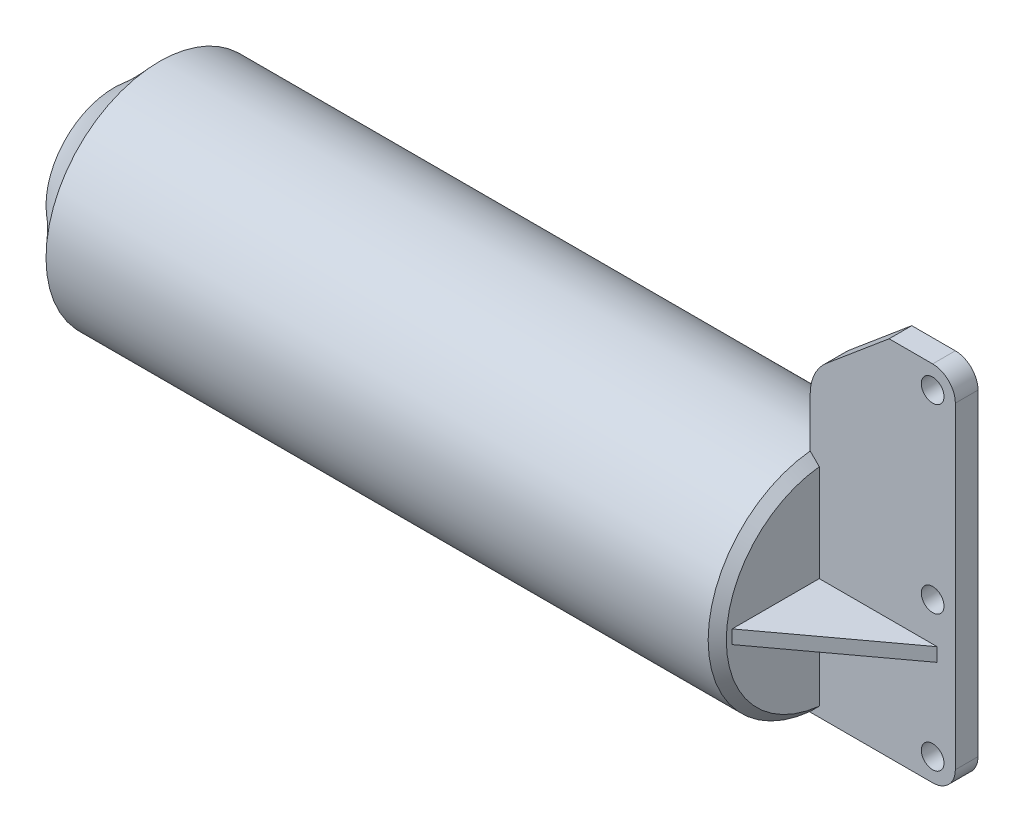
from build123d import *
from build123d.topology import SkipClean

# Parameters (mm, degrees)
SKETCH1_R                = 12.5
BOSS_EXTRUDE1_DEPTH      = 59
SKETCH2_R                = 7.5
BOSS_EXTRUDE2_DEPTH      = 5
CHAMFER1_SIZE            = 1
BOSS_EXTRUDE3_DEPTH      = 27.5
BOSS_EXTRUDE3_DEPTH_BACK = 12.5
FILLET1_R                = 2.5
SKETCH4_R                = 1.25
CUT_EXTRUDE1_DEPTH       = 27.5
CUT_EXTRUDE2_DEPTH       = 27.5
FILLET2_R                = 5
SKETCH6_R                = 1.25
CUT_EXTRUDE3_DEPTH       = 27.5
RIB1_REACH               = 81.928
SKETCH7_WALL_W           = 178.016630936
SKETCH7_WALL_H           = 1.5
SKETCH9_R                = 12.5
BOSS_EXTRUDE5_DEPTH      = 10
SKETCH10_R               = 12.5
BOSS_EXTRUDE6_DEPTH      = 10
SKETCH11_R               = 7.5
BOSS_EXTRUDE7_DEPTH      = 5


with BuildPart() as part:
    # Sketch1 → Boss-Extrude1 (new body)
    with BuildSketch(Plane(origin=(0, 0, 0), x_dir=(0, 0, -1), z_dir=(1, 0, 0))):
        with Locations(Location((0, 0, 0), (0, 0, 180))):
            Circle(SKETCH1_R)
    extrude(amount=BOSS_EXTRUDE1_DEPTH)

    # Sketch2 → Boss-Extrude2 (add)
    with BuildSketch(Plane.ZY):
        Circle(SKETCH2_R)
    extrude(amount=BOSS_EXTRUDE2_DEPTH)

    # loft up to a face of the part (loft1)
    loft([Face(Wire([part.edges().sort_by_distance((0, 9.112107843, -8.556838824))[0]])), Face(Wire([part.edges().sort_by_distance((-5, 5.467264706, -5.134103294))[0]]))])

    # Chamfer1
    chamfer1_edges = [part.edges().sort_by_distance(p)[0] for p in [
        (59, 0, -12.5),
    ]]
    chamfer(chamfer1_edges, length=CHAMFER1_SIZE)

    # Sketch3 → Boss-Extrude3 (add, two sides: drawn at the far end of the back side and taken through both)
    with BuildSketch(Plane(origin=(0, 0, 0), x_dir=(1, 0, 0), z_dir=(0, 1, 0)).offset(-BOSS_EXTRUDE3_DEPTH_BACK)):
        Polygon((59, 1.25), (74, 1.25), (74, -1.25), (59, -1.25), (58, -1.25), (58, 1.25), align=None)
    extrude(amount=BOSS_EXTRUDE3_DEPTH + BOSS_EXTRUDE3_DEPTH_BACK)

    # Fillet1
    fillet1_edges = [part.edges().sort_by_distance(p)[0] for p in [
        (74, -12.5, 0),
        (74, 27.5, 0),
    ]]
    fillet(fillet1_edges, radius=FILLET1_R)

    # Sketch4 → Cut-Extrude1 (cut)
    with BuildSketch(Plane.XY.offset(1.25)):
        with Locations((71.5, -10)):
            Circle(SKETCH4_R)
        with Locations((71.5, 25)):
            Circle(SKETCH4_R)
    extrude(amount=-CUT_EXTRUDE1_DEPTH, mode=Mode.SUBTRACT)

    # Sketch5 → Cut-Extrude2 (cut)
    with BuildSketch(Plane.XY.offset(1.25)):
        Polygon((58, 20.199191426), (66.700764847, 27.5), (58, 27.5), align=None)
    extrude(amount=-CUT_EXTRUDE2_DEPTH, mode=Mode.SUBTRACT)

    # Fillet2
    fillet2_edges = [part.edges().sort_by_distance(p)[0] for p in [
        (58, 20.199191426, 0),
    ]]
    fillet(fillet2_edges, radius=FILLET2_R)

    # Sketch6 → Cut-Extrude3 (cut)
    with BuildSketch(Plane.XY.offset(1.25)):
        with Locations((71.5, 5)):
            Circle(SKETCH6_R)
        with Locations((71.5, -10)):
            Circle(SKETCH6_R)
    extrude(amount=-CUT_EXTRUDE3_DEPTH, mode=Mode.SUBTRACT)

    # Sketch7 wall → Rib1 (add, up to next)
    with BuildSketch(Plane(origin=(65.5, 0, 6.05), x_dir=(0.80443326696, 0, -0.594043027909), z_dir=(-0.594043027909, 0, -0.80443326696)), mode=Mode.PRIVATE) as rib1_sk1:
        Rectangle(SKETCH7_WALL_W, SKETCH7_WALL_H)
    rib1_tool1 = extrude(rib1_sk1.sketch, amount=RIB1_REACH, mode=Mode.PRIVATE) - part.part
    rib1 = rib1_tool1.solids().sort_by_distance((65.5, 0, 6.05))[0]
    add(rib1)

    # Mirror1: Rib1 across plane
    add(rib1.mirror(Plane.XY))



with BuildPart() as body_2:
    # Sketch9 → Boss-Extrude5 (new body)
    with BuildSketch(Plane.ZY.offset(5)):
        with Locations(Location((0, 0, 0), (0, 0, 84.260829523))):
            Circle(SKETCH9_R)
    extrude(amount=BOSS_EXTRUDE5_DEPTH)


with BuildPart() as part_1:
    with SkipClean():  # the faces are left unmerged after this step: merging them gives an invalid solid
        add(part.part)

        add(body_2.part)  # Boss-Extrude6 merges body 2
        # Sketch10 → Boss-Extrude6 (add)
        with BuildSketch(Plane(origin=(-5, 0, 0), x_dir=(0, 0, -1), z_dir=(1, 0, 0))):
            with Locations(Location((0, 0, 0), (0, 0, 180))):
                Circle(SKETCH10_R)
        extrude(amount=BOSS_EXTRUDE6_DEPTH)

    # Sketch11 → Boss-Extrude7 (add)
    with SkipClean():  # the faces are left unmerged after this step: merging them gives an invalid solid
        with BuildSketch(Plane.ZY.offset(15)):
            Circle(SKETCH11_R)
        extrude(amount=BOSS_EXTRUDE7_DEPTH)

    # Loft2: read off the stored shape, not the designer's step
    # Loft2: loft between two sections, ruled curve by curve
    with SkipClean():  # the faces are left unmerged after this step: merging them gives an invalid solid
        loft2_from = [
            Edge.make_bspline([(-15, 9.967693129, -7.542883646), (-15, -5.118074163, -27.478269903), (-15, -25.05346042, -12.392502611), (-15, -9.967693129, 7.542883646), (-15, 5.118074163, 27.478269903), (-15, 25.05346042, 12.392502611), (-15, 9.967693129, -7.542883646)], [0, 0, 0, 0, 0.5, 0.5, 0.5, 1, 1, 1, 1], 3, [1, 0.333333333, 0.333333333, 1, 0.333333333, 0.333333333, 1]),
        ]
        loft2_to = [
            Edge.make_bspline([(-20, 7.220329767, -2.028999276), (-20, 3.162331215, -16.469658809), (-20, -11.278328318, -12.411660258), (-20, -7.220329767, 2.028999276), (-20, -3.162331215, 16.469658809), (-20, 11.278328318, 12.411660258), (-20, 7.220329767, -2.028999276)], [0, 0, 0, 0, 0.5, 0.5, 0.5, 1, 1, 1, 1], 3, [1, 0.333333333, 0.333333333, 1, 0.333333333, 0.333333333, 1]),
        ]
        loft2 = Solid(Shell([*[Face.make_surface_from_curves(loft2_from[k], loft2_to[k]) for k in range(1)], Face(Wire(loft2_from)), Face(Wire(loft2_to))]))
        add(loft2)


solid = part_1.part
